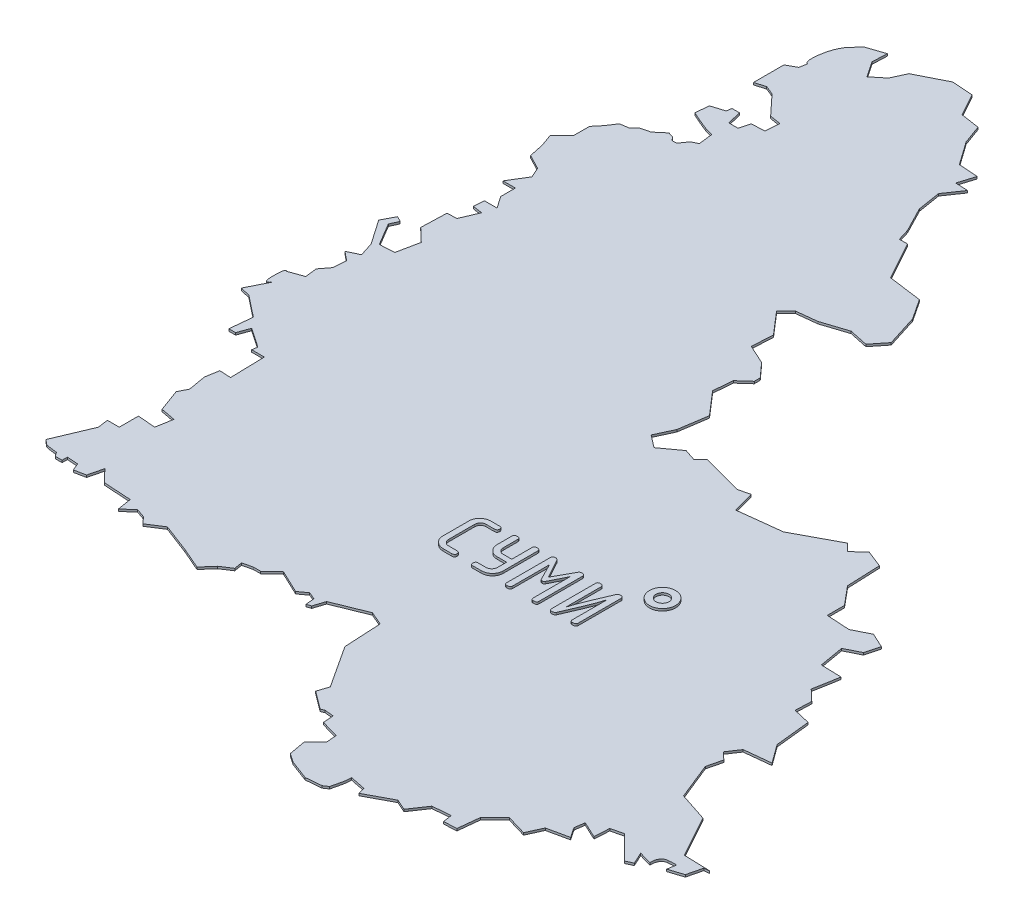
from build123d import *

# Parameters (mm, degrees)
EXTRUDE_2_DEPTH = 5
SKETCH_2_R      = 30
SKETCH_2_R_2    = 15
EXTRUDE_3_DEPTH = 10
SCALE_1_SCALE   = 0.05


with BuildPart() as part:
    # Эскиз1 → Бобышка-Вытянуть2 (new body)
    with BuildSketch(Plane(origin=(0, 0, 0), x_dir=(1, 0, 0), z_dir=(0, 1, 0))):
        with BuildLine():
            Line((879.09908, 7572.42834), (889.50546, 7563.34022))
            Line((889.50546, 7563.34022), (893.42468, 7562.0372))
            Line((893.42468, 7562.0372), (916.74442, 7558.79362))
            Line((916.74442, 7558.79362), (923.21126, 7549.71058))
            Line((923.21126, 7549.71058), (938.81448, 7549.71058))
            Line((938.81448, 7549.71058), (938.81448, 7562.0372))
            Line((938.81448, 7562.0372), (964.12812, 7560.07124))
            Line((964.12812, 7560.07124), (971.2706, 7543.21834))
            Line((971.2706, 7543.21834), (996.5944, 7548.40756))
            Line((996.5944, 7548.40756), (1004.99418, 7582.17178))
            Line((1004.99418, 7582.17178), (1032.26108, 7553.5917))
            Line((1032.26108, 7553.5917), (1095.84236, 7549.71058))
            Line((1095.84236, 7549.71058), (1101.0392, 7517.257))
            Line((1101.0392, 7517.257), (1124.3945, 7538.03928))
            Line((1124.3945, 7538.03928), (1145.18694, 7530.8841))
            Line((1145.18694, 7530.8841), (1158.8115, 7515.95652))
            Line((1158.8115, 7515.95652), (1193.18278, 7538.03928))
            Line((1193.18278, 7538.03928), (1259.4082, 7512.7104))
            Line((1259.4082, 7512.7104), (1307.40404, 7491.95352))
            Line((1307.40404, 7491.95352), (1329.48172, 7517.257))
            Line((1329.48172, 7517.257), (1353.4771, 7532.8272))
            Line((1353.4771, 7532.8272), (1350.25638, 7551.6486))
            Line((1350.25638, 7551.6486), (1372.31628, 7556.84798))
            Line((1372.31628, 7556.84798), (1389.16918, 7556.84798))
            Line((1389.16918, 7556.84798), (1416.43608, 7582.17178))
            Line((1416.43608, 7582.17178), (1469.62114, 7556.84798))
            Line((1469.62114, 7556.84798), (1488.43492, 7570.46746))
            Line((1488.43492, 7570.46746), (1505.34116, 7563.34022))
            Line((1505.34116, 7563.34022), (1507.26648, 7543.21834))
            Line((1507.26648, 7543.21834), (1517.015, 7546.46446))
            Line((1517.015, 7546.46446), (1525.45796, 7572.42834))
            Line((1525.45796, 7572.42834), (1600.73086, 7602.9185))
            Line((1600.73086, 7602.9185), (1631.85602, 7589.29394))
            Line((1631.85602, 7589.29394), (1636.42548, 7503.64006))
            Line((1636.42548, 7503.64006), (1700.02454, 7406.28694))
            Line((1700.02454, 7406.28694), (1691.57904, 7380.98854))
            Line((1691.57904, 7380.98854), (1732.42732, 7350.47806))
            Line((1732.42732, 7350.47806), (1740.90584, 7353.72926))
            Line((1740.90584, 7353.72926), (1761.00486, 7351.77854))
            Line((1761.00486, 7351.77854), (1762.96574, 7327.76792))
            Line((1762.96574, 7327.76792), (1803.8318, 7316.08392))
            Line((1803.8318, 7316.08392), (1805.76474, 7292.08346))
            Line((1805.76474, 7292.08346), (1779.84658, 7266.77236))
            Line((1779.84658, 7266.77236), (1786.98652, 7227.17376))
            Line((1786.98652, 7227.17376), (1807.07792, 7213.5492))
            Line((1807.07792, 7213.5492), (1851.84542, 7196.70138))
            Line((1851.84542, 7196.70138), (1887.54004, 7199.92972))
            Line((1887.54004, 7199.92972), (1897.94388, 7207.06204))
            add(Edge.make_bspline(
                [(1904.705552798, 7250.097162508), (1907.778973749, 7244.241091087), (1897.94388, 7207.06204)],
                knots=[0.799002099, 0.799002099, 0.799002099, 0.802469136, 0.802469136, 0.802469136], degree=2))
            add(Edge.make_bspline(
                [(1940.768280005, 7242.746499999), (1912.10791526, 7248.151202402), (1904.705552798, 7250.097162508)],
                knots=[0.794238683, 0.794238683, 0.794238683, 0.796872225, 0.796872225, 0.796872225], degree=2))
            Line((1940.768280005, 7242.746499999), (1945.309800005, 7227.173759999))
            Line((1945.309800005, 7227.173759999), (2003.701860005, 7258.334479999))
            Line((2003.701860005, 7258.334479999), (2028.377960005, 7247.300719999))
            Line((2028.377960005, 7247.300719999), (2032.886460005, 7253.145259999))
            Line((2032.886460005, 7253.145259999), (2054.979380005, 7285.588679999))
            Line((2054.979380005, 7285.588679999), (2095.863220005, 7288.839879999))
            Line((2095.863220005, 7288.839879999), (2099.101720005, 7268.065219999))
            Line((2099.101720005, 7268.065219999), (2128.293940005, 7270.008319999))
            Line((2128.293940005, 7270.008319999), (2133.490780005, 7319.332579999))
            Line((2133.490780005, 7319.332579999), (2167.249920005, 7351.778539999))
            Line((2167.249920005, 7351.778539999), (2213.330600005, 7338.141279999))
            Line((2213.330600005, 7338.141279999), (2228.931280005, 7372.543039999))
            Line((2228.931280005, 7372.543039999), (2276.911880005, 7382.929099999))
            Line((2276.911880005, 7382.929099999), (2261.344220005, 7406.286939999))
            Line((2261.344220005, 7406.286939999), (2264.582720005, 7429.002159999))
            Line((2264.582720005, 7429.002159999), (2302.217900005, 7411.486319999))
            Line((2302.217900005, 7411.486319999), (2304.186400005, 7445.877919999))
            Line((2304.186400005, 7445.877919999), (2331.445680005, 7452.375239999))
            Line((2331.445680005, 7452.375239999), (2385.933760005, 7397.861759999))
            Line((2385.933760005, 7397.861759999), (2401.511580005, 7404.999159999))
            Line((2401.511580005, 7404.999159999), (2389.172260005, 7432.248279999))
            Line((2389.172260005, 7432.248279999), (2418.372100005, 7423.812939999))
            add(Edge.make_bspline(
                [(2435.252940005, 7449.129119999), (2418.372100005, 7447.815939999), (2418.372100005, 7423.812939999)],
                knots=[0.699588477, 0.699588477, 0.699588477, 0.703703704, 0.703703704, 0.703703704], degree=2))
            add(Edge.make_bspline(
                [(2454.084500005, 7449.129119999), (2452.781480005, 7451.067139999), (2435.252940005, 7449.129119999)],
                knots=[0.695473251, 0.695473251, 0.695473251, 0.699588477, 0.699588477, 0.699588477], degree=2))
            Line((2454.084500005, 7449.129119999), (2450.846000005, 7430.292479999))
            Line((2450.846000005, 7430.292479999), (2483.302120005, 7440.688699999))
            Line((2483.302120005, 7440.688699999), (2491.712060005, 7475.085379999))
            Line((2491.712060005, 7475.085379999), (2504.059000005, 7475.730539999))
            Line((2504.059000005, 7475.730539999), (2503.375740005, 7476.380779999))
            Line((2503.375740005, 7476.380779999), (2443.688280005, 7478.323879999))
            Line((2443.688280005, 7478.323879999), (2391.133140005, 7573.705959999))
            Line((2391.133140005, 7573.705959999), (2324.305740005, 7595.783639999))
            Line((2324.305740005, 7595.783639999), (2290.518660005, 7679.489339999))
            Line((2290.518660005, 7679.489339999), (2298.989560005, 7713.893639999))
            Line((2298.989560005, 7713.893639999), (2282.083320005, 7729.466379999))
            Line((2282.083320005, 7729.466379999), (2300.292580005, 7756.723119999))
            Line((2300.292580005, 7756.723119999), (2360.627740005, 7763.197579999))
            Line((2360.627740005, 7763.197579999), (2329.484800005, 7806.037219999))
            Line((2329.484800005, 7806.037219999), (2321.049460005, 7885.849099999))
            Line((2321.049460005, 7885.849099999), (2282.083320005, 7894.942299999))
            Line((2282.083320005, 7894.942299999), (2283.404120005, 7931.929779999))
            Line((2283.404120005, 7931.929779999), (2258.080320005, 7955.948019999))
            Line((2258.080320005, 7955.948019999), (2268.466380005, 8014.340079999))
            Line((2268.466380005, 8014.340079999), (2221.791340005, 8015.632939999))
            Line((2221.791340005, 8015.632939999), (2212.017420005, 8072.102219999))
            Line((2212.017420005, 8072.102219999), (2245.768940005, 8088.977979999))
            Line((2245.768940005, 8088.977979999), (2254.186500005, 8121.423939999))
            Line((2254.186500005, 8121.423939999), (2220.452760005, 8137.004299999))
            Line((2220.452760005, 8137.004299999), (2182.817580005, 8118.180359999))
            Line((2182.817580005, 8118.180359999), (2129.604580005, 8121.423939999))
            Line((2129.604580005, 8121.423939999), (2129.604580005, 8161.002219999))
            Line((2129.604580005, 8161.002219999), (2093.930280005, 8203.831699999))
            Line((2093.930280005, 8203.831699999), (2090.681620005, 8280.412699999))
            Line((2090.681620005, 8280.412699999), (2051.761200005, 8295.987979999))
            Line((2051.761200005, 8295.987979999), (2025.771920005, 8271.979899999))
            Line((2025.771920005, 8271.979899999), (2008.901240005, 8288.837879999))
            Line((2008.901240005, 8288.837879999), (1912.871460005, 8237.570519999))
            Line((1912.871460005, 8237.570519999), (1814.243260005, 8225.891599999))
            Line((1814.243260005, 8225.891599999), (1800.593300005, 8275.210779999))
            Line((1800.593300005, 8275.210779999), (1774.629420005, 8268.731239999))
            Line((1774.629420005, 8268.731239999), (1681.210760005, 8294.037259999))
            Line((1681.210760005, 8294.037259999), (1665.635480005, 8278.459439999))
            Line((1665.635480005, 8278.459439999), (1638.366040005, 8287.552639999))
            Line((1638.366040005, 8287.552639999), (1595.534020005, 8256.404619999))
            Line((1595.534020005, 8256.404619999), (1566.979340005, 8278.459439999))
            Line((1566.979340005, 8278.459439999), (1585.803280005, 8319.355979999))
            Line((1585.803280005, 8319.355979999), (1595.534020005, 8384.227579999))
            Line((1595.534020005, 8384.227579999), (1549.445720005, 8437.453279999))
            Line((1549.445720005, 8437.453279999), (1553.364940005, 8481.583239999))
            Line((1553.364940005, 8481.583239999), (1578.670960005, 8504.290839999))
            Line((1578.670960005, 8504.290839999), (1578.670960005, 8517.920479999))
            Line((1578.670960005, 8517.920479999), (1549.445720005, 8550.371519999))
            Line((1549.445720005, 8550.371519999), (1505.341160005, 8570.475619999))
            Line((1505.341160005, 8570.475619999), (1508.597440005, 8618.512099999))
            Line((1508.597440005, 8618.512099999), (1464.442080005, 8669.759139999))
            Line((1464.442080005, 8669.759139999), (1486.519760005, 8691.831739999))
            Line((1486.519760005, 8691.831739999), (1532.615680005, 8697.028579999))
            Line((1532.615680005, 8697.028579999), (1590.334640005, 8715.842359999))
            Line((1590.334640005, 8715.842359999), (1633.159040005, 8706.761859999))
            Line((1633.159040005, 8706.761859999), (1659.158480005, 8739.197659999))
            Line((1659.158480005, 8739.197659999), (1636.425480005, 8811.242219999))
            Line((1636.425480005, 8811.242219999), (1605.894680005, 8857.325439999))
            Line((1605.894680005, 8857.325439999), (1529.326380005, 8867.691179999))
            Line((1529.326380005, 8867.691179999), (1481.320380005, 8954.645539999))
            Line((1481.320380005, 8954.645539999), (1462.506600005, 8954.645539999))
            Line((1462.506600005, 8954.645539999), (1454.081420005, 8981.907359999))
            Line((1454.081420005, 8981.907359999), (1424.863800005, 9038.361399999))
            Line((1424.863800005, 9038.361399999), (1416.436080005, 9090.931779999))
            Line((1416.436080005, 9090.931779999), (1443.677580005, 9130.510059999))
            Line((1443.677580005, 9130.510059999), (1415.122900005, 9131.818159999))
            Line((1415.122900005, 9131.818159999), (1426.822140005, 9169.453339999))
            Line((1426.822140005, 9169.453339999), (1382.676940005, 9172.709619999))
            Line((1382.676940005, 9172.709619999), (1345.039220005, 9225.917539999))
            Line((1345.039220005, 9225.917539999), (1329.481720005, 9268.747019999))
            Line((1329.481720005, 9268.747019999), (1286.611600005, 9275.221479999))
            Line((1286.611600005, 9275.221479999), (1258.095020005, 9326.496459999))
            Line((1258.095020005, 9326.496459999), (1210.071240005, 9329.742579999))
            Line((1210.071240005, 9329.742579999), (1143.218440005, 9295.985979999))
            Line((1143.218440005, 9295.985979999), (1128.306100005, 9263.552719999))
            Line((1128.306100005, 9263.552719999), (1101.039200005, 9241.490279999))
            Line((1101.039200005, 9241.490279999), (1077.020960005, 9277.182359999))
            Line((1077.020960005, 9277.182359999), (1078.359540005, 9310.923719999))
            Line((1078.359540005, 9310.923719999), (1037.450300005, 9297.294079999))
            Line((1037.450300005, 9297.294079999), (1017.315720005, 9273.938779999))
            add(Edge.make_bspline(
                [(1001.773460005, 9227.855559999), (1004.994180005, 9255.112299999), (1017.315720005, 9273.938779999)],
                knots=[0.362139918, 0.362139918, 0.362139918, 0.366255144, 0.366255144, 0.366255144], degree=2))
            add(Edge.make_bspline(
                [(1006.955060005, 9198.658259999), (998.501940005, 9200.596279999), (1001.773460005, 9227.855559999)],
                knots=[0.358024691, 0.358024691, 0.358024691, 0.362139918, 0.362139918, 0.362139918], degree=2))
            Line((1006.955060005, 9198.658259999), (1003.716560005, 9181.774879999))
            Line((1003.716560005, 9181.774879999), (981.649040005, 9169.453339999))
            Line((981.649040005, 9169.453339999), (981.649040005, 9099.372199999))
            Line((981.649040005, 9099.372199999), (1004.994180005, 9106.499439999))
            Line((1004.994180005, 9106.499439999), (1025.768840005, 9098.071719999))
            Line((1025.768840005, 9098.071719999), (1068.603400005, 9051.991039999))
            Line((1068.603400005, 9051.991039999), (1093.917040005, 9048.089599999))
            Line((1093.917040005, 9048.089599999), (1091.973940005, 9015.646179999))
            Line((1091.973940005, 9015.646179999), (1061.460920005, 9014.338079999))
            Line((1061.460920005, 9014.338079999), (1054.994080005, 8990.342699999))
            Line((1054.994080005, 8990.342699999), (1034.211800005, 8990.342699999))
            Line((1034.211800005, 8990.342699999), (1025.768840005, 9022.798819999))
            Line((1025.768840005, 9022.798819999), (1008.888000005, 9022.798819999))
            Line((1008.888000005, 9022.798819999), (1006.955060005, 9011.104659999))
            Line((1006.955060005, 9011.104659999), (977.745060005, 9002.034319999))
            Line((977.745060005, 9002.034319999), (974.524340005, 8971.526379999))
            Line((974.524340005, 8971.526379999), (993.320340005, 8963.073259999))
            Line((993.320340005, 8963.073259999), (1018.636520005, 8952.720219999))
            Line((1018.636520005, 8952.720219999), (1037.450300005, 8947.513219999))
            Line((1037.450300005, 8947.513219999), (1041.336500005, 8915.072339999))
            Line((1041.336500005, 8915.072339999), (1027.711940005, 8908.582639999))
            Line((1027.711940005, 8908.582639999), (1014.087380005, 8889.756159999))
            Line((1014.087380005, 8889.756159999), (1003.716560005, 8889.756159999))
            Line((1003.716560005, 8889.756159999), (996.594400005, 8898.191499999))
            Line((996.594400005, 8898.191499999), (984.885000005, 8901.424919999))
            Line((984.885000005, 8901.424919999), (962.789540005, 8882.621299999))
            Line((962.789540005, 8882.621299999), (942.068220005, 8877.426999999))
            Line((942.068220005, 8877.426999999), (930.368980005, 8865.748079999))
            Line((930.368980005, 8865.748079999), (909.579080005, 8862.494339999))
            Line((909.579080005, 8862.494339999), (895.987540005, 8841.729839999))
            Line((895.987540005, 8841.729839999), (880.404640005, 8822.916059999))
            Line((880.404640005, 8822.916059999), (880.404640005, 8787.229059999))
            Line((880.404640005, 8787.229059999), (853.145360005, 8759.959619999))
            Line((853.145360005, 8759.959619999), (863.533960005, 8730.762319999))
            Line((863.533960005, 8730.762319999), (870.673900005, 8697.028579999))
            Line((870.673900005, 8697.028579999), (904.405100005, 8679.494959999))
            Line((904.405100005, 8679.494959999), (914.793700005, 8656.142199999))
            Line((914.793700005, 8656.142199999), (889.505460005, 8614.618279999))
            Line((889.505460005, 8614.618279999), (918.0576, 8614.618279999))
            Line((918.0576, 8614.618279999), (918.0576, 8580.86676))
            Line((918.0576, 8580.86676), (936.8536, 8553.60494))
            Line((936.8536, 8553.60494), (907.6436, 8553.60494))
            Line((907.6436, 8553.60494), (906.35836, 8529.60194))
            Line((906.35836, 8529.60194), (928.44366, 8526.35582))
            Line((928.44366, 8526.35582), (911.58314, 8486.75722))
            Line((911.58314, 8486.75722), (889.50546, 8485.47198))
            Line((889.50546, 8485.47198), (887.5522, 8427.06214))
            Line((887.5522, 8427.06214), (918.0576, 8397.86738))
            Line((918.0576, 8397.86738), (907.6436, 8347.24518))
            Line((907.6436, 8347.24518), (873.90986, 8345.297))
            Line((873.90986, 8345.297), (843.41462, 8396.5796))
            Line((843.41462, 8396.5796), (851.89568, 8415.38576))
            Line((851.89568, 8415.38576), (839.53096, 8421.878))
            Line((839.53096, 8421.878), (824.59322, 8393.32078))
            Line((824.59322, 8393.32078), (863.53396, 8336.85658))
            Line((863.53396, 8336.85658), (873.90986, 8304.42332))
            Line((873.90986, 8304.42332), (847.97392, 8292.08146))
            Line((847.97392, 8292.08146), (868.71302, 8275.21078))
            Line((868.71302, 8275.21078), (866.76992, 8246.01348))
            Line((866.76992, 8246.01348), (849.91702, 8223.9485))
            Line((849.91702, 8223.9485), (853.14536, 8196.69938))
            Line((853.14536, 8196.69938), (820.70702, 8185.00522))
            add(Edge.make_bspline(
                [(814.22494, 8161.00222), (814.22494, 8191.50762), (820.70702, 8185.00522)],
                knots=[0.098765432, 0.098765432, 0.098765432, 0.102880658, 0.102880658, 0.102880658], degree=2))
            add(Edge.make_bspline(
                [(825.91402, 8147.37766), (814.22494, 8130.5019), (814.22494, 8161.00222)],
                knots=[0.094650206, 0.094650206, 0.094650206, 0.098765432, 0.098765432, 0.098765432], degree=2))
            Line((825.91402, 8147.37766), (801.89324, 8099.36658))
            Line((801.89324, 8099.36658), (824.59322, 8094.15704))
            Line((824.59322, 8094.15704), (873.90986, 8055.22646))
            Line((873.90986, 8055.22646), (868.71302, 8003.96418))
            Line((868.71302, 8003.96418), (884.28068, 8003.96418))
            Line((884.28068, 8003.96418), (894.04698, 8031.20568))
            Line((894.04698, 8031.20568), (938.81448, 8000.70536))
            Line((938.81448, 8000.70536), (936.8536, 7988.3889))
            Line((936.8536, 7988.3889), (966.0636, 7988.3889))
            Line((966.0636, 7988.3889), (967.99654, 7908.56686))
            Line((967.99654, 7908.56686), (942.06822, 7909.87496))
            Line((942.06822, 7909.87496), (936.8536, 7879.36956))
            Line((936.8536, 7879.36956), (944.0037, 7838.48318))
            Line((944.0037, 7838.48318), (933.64304, 7817.70852))
            Line((933.64304, 7817.70852), (952.41364, 7766.46148))
            Line((952.41364, 7766.46148), (986.1804, 7759.96162))
            Line((986.1804, 7759.96162), (979.68816, 7722.33914))
            Line((979.68816, 7722.33914), (938.81448, 7725.5624))
            Line((938.81448, 7725.5624), (938.81448, 7681.4553))
            Line((938.81448, 7681.4553), (911.58314, 7681.4553))
            Line((911.58314, 7681.4553), (914.7937, 7657.4269))
            Line((914.7937, 7657.4269), (879.09908, 7572.42834))
        make_face()
    extrude(amount=EXTRUDE_2_DEPTH)

    # Эскиз2 → Бобышка-Вытянуть3 (add)
    # profile 1 of 5: a face of its own
    with BuildSketch(Plane(origin=(0, 0, 0), x_dir=(1, 0, 0), z_dir=(0, 1, 0))):
        with Locations((1910.21910007, 7961.332933556)):
            Circle(SKETCH_2_R)
        with Locations((1910.21910007, 7961.332933556)):
            Circle(SKETCH_2_R_2, mode=Mode.SUBTRACT)
    # profile 2 of 5: a face of its own
    with BuildSketch(Plane(origin=(0, 0, 0), x_dir=(1, 0, 0), z_dir=(0, 1, 0))):
        with BuildLine():
            Line((1578.562321814, 7807.069016626), (1559.400581949, 7807.069016626))
            add(Edge.make_bspline(
                [(1559.400581949, 7807.069016626), (1558.56346375, 7807.093002103), (1556.906156653, 7807.140487991), (1554.454497929, 7807.469129855), (1552.084266485, 7808.028919047), (1549.781506886, 7808.803528493), (1547.55136386, 7809.797095835), (1545.407764698, 7811.044675055), (1543.33610776, 7812.492172903), (1541.346370335, 7814.121631339), (1539.542024346, 7815.93342505), (1537.936381697, 7817.853528532), (1536.581477029, 7819.886058195), (1535.467759027, 7822.019227873), (1534.594042915, 7824.244877162), (1533.996664084, 7826.569709102), (1533.607624322, 7828.989286653), (1533.569150559, 7830.642234155), (1533.549652895, 7831.479911896)],
                knots=[0, 0, 0, 0, 1.018867561, 2.017130245, 3.004614605, 3.979107864, 4.970407086, 5.970980155, 6.993154606, 8.044116266, 9.096977523, 10.100873513, 11.086242139, 12.064146942, 13.024919106, 13.989519707, 14.981132439, 16, 16, 16, 16], degree=3))
            Line((1533.549652895, 7831.479911896), (1533.549652895, 7892.658121356))
            add(Edge.make_bspline(
                [(1533.549652895, 7892.658121356), (1533.56845312, 7893.495914719), (1533.605378814, 7895.141432295), (1534.00281731, 7897.559321641), (1534.59023201, 7899.886151898), (1535.462170421, 7902.114160709), (1536.588413502, 7904.232827419), (1537.935749824, 7906.261476747), (1539.541320635, 7908.182303384), (1541.353555489, 7909.992567638), (1543.330100339, 7911.644063456), (1545.404015142, 7913.107074115), (1547.578923877, 7914.293874553), (1549.784869638, 7915.354375262), (1552.096119426, 7916.09716785), (1554.460787139, 7916.673736793), (1556.906464907, 7916.996556379), (1558.563567198, 7917.044699285), (1559.400581949, 7917.069016626)],
                knots=[0, 0, 0, 0, 1.0191145, 2.001652071, 2.975606382, 3.936611404, 4.906405939, 5.892013384, 6.896152684, 7.949269119, 9.006511641, 10.028933832, 11.033294323, 12.020163057, 13.003830373, 13.982380872, 14.9808855, 16, 16, 16, 16], degree=3))
            Line((1559.400581949, 7917.069016626), (1578.562321814, 7917.069016626))
            add(Edge.make_bspline(
                [(1578.562321814, 7917.069016626), (1579.097710196, 7917.053154765), (1580.107077731, 7917.023250404), (1581.515776313, 7916.753332785), (1582.713873491, 7916.280935001), (1583.71645491, 7915.63482859), (1584.482973588, 7914.762502306), (1585.031199111, 7913.713224442), (1585.321110815, 7912.469680691), (1585.366733412, 7911.588984794), (1585.390869112, 7911.12307068)],
                knots=[0, 0, 0, 0, 1.239032302, 2.335947183, 3.301339876, 4.206248485, 5.069721959, 5.959770044, 6.920658157, 8, 8, 8, 8], degree=3))
            add(Edge.make_bspline(
                [(1585.390869112, 7911.12307068), (1585.366733412, 7910.657156566), (1585.321110815, 7909.776460669), (1585.031199111, 7908.532916918), (1584.482973588, 7907.483639053), (1583.71645491, 7906.61131277), (1582.713873491, 7905.965206358), (1581.515776313, 7905.492808575), (1580.107077731, 7905.222890956), (1579.097710196, 7905.192986595), (1578.562321814, 7905.177124734)],
                knots=[0, 0, 0, 0, 1.079341843, 2.040229956, 2.930278041, 3.793751515, 4.698660124, 5.664052817, 6.760967698, 8, 8, 8, 8], degree=3))
            Line((1578.562321814, 7905.177124734), (1559.400581949, 7905.177124734))
            add(Edge.make_bspline(
                [(1559.400581949, 7905.177124734), (1558.620767333, 7905.133785809), (1557.06792344, 7905.047485059), (1554.810636234, 7904.300616221), (1552.671969905, 7903.125908515), (1550.722421981, 7901.495329681), (1549.014370307, 7899.543480367), (1547.811401215, 7897.198660568), (1547.036881339, 7894.596175739), (1546.965008257, 7892.749048946), (1546.928031274, 7891.798746356)],
                knots=[0, 0, 0, 0, 0.919483398, 1.830966167, 2.780942374, 3.788393713, 4.820470715, 5.823133069, 6.880053989, 8, 8, 8, 8], degree=3))
            Line((1546.928031274, 7891.798746356), (1546.928031274, 7832.339286896))
            add(Edge.make_bspline(
                [(1546.928031274, 7832.339286896), (1546.966449005, 7831.381926802), (1547.040444958, 7829.537966474), (1547.78567409, 7826.916263976), (1549.015884415, 7824.591042165), (1550.697710172, 7822.603563353), (1552.661596618, 7821.000715513), (1554.803432774, 7819.829486115), (1557.061332729, 7819.093508065), (1558.621037948, 7819.005096704), (1559.400581949, 7818.960908518)],
                knots=[0, 0, 0, 0, 1.127983622, 2.172596354, 3.186649798, 4.21184702, 5.225406005, 6.162066987, 7.081397153, 8, 8, 8, 8], degree=3))
            Line((1559.400581949, 7818.960908518), (1578.562321814, 7818.960908518))
            add(Edge.make_bspline(
                [(1578.562321814, 7818.960908518), (1579.097710196, 7818.945046657), (1580.107077731, 7818.915142296), (1581.515776313, 7818.645224677), (1582.713873491, 7818.172826893), (1583.71645491, 7817.526720481), (1584.482973588, 7816.654394198), (1585.031199111, 7815.605116334), (1585.321110815, 7814.361572582), (1585.366733412, 7813.480876686), (1585.390869112, 7813.014962572)],
                knots=[0, 0, 0, 0, 1.239032302, 2.335947183, 3.301339876, 4.206248485, 5.069721959, 5.959770044, 6.920658157, 8, 8, 8, 8], degree=3))
            add(Edge.make_bspline(
                [(1585.390869112, 7813.014962572), (1585.366733412, 7812.549048458), (1585.321110815, 7811.668352561), (1585.031199111, 7810.42480881), (1584.482973588, 7809.375530945), (1583.71645491, 7808.503204662), (1582.713873491, 7807.85709825), (1581.515776313, 7807.384700466), (1580.107077731, 7807.114782848), (1579.097710196, 7807.084878487), (1578.562321814, 7807.069016626)],
                knots=[0, 0, 0, 0, 1.079341843, 2.040229956, 2.930278041, 3.793751515, 4.698660124, 5.664052817, 6.760967698, 8, 8, 8, 8], degree=3))
        make_face()
    # profile 3 of 5: a face of its own
    with BuildSketch(Plane(origin=(0, 0, 0), x_dir=(1, 0, 0), z_dir=(0, 1, 0))):
        with BuildLine():
            Line((1659.306409652, 7853.150097707), (1637.705902895, 7853.150097707))
            add(Edge.make_bspline(
                [(1637.705902895, 7853.150097707), (1636.868855667, 7853.174167631), (1635.219362663, 7853.221600047), (1632.796669878, 7853.543824708), (1630.476115464, 7854.116565872), (1628.241817037, 7854.869677009), (1626.110801904, 7855.882130456), (1624.086305778, 7857.121736207), (1622.153064557, 7858.570816206), (1620.321247587, 7860.20673738), (1618.677182483, 7862.022695931), (1617.213599201, 7863.944210555), (1615.985494339, 7865.961055948), (1614.974165082, 7868.077666773), (1614.180820002, 7870.286152492), (1613.626912509, 7872.591451758), (1613.294140338, 7874.988639793), (1613.248566686, 7876.615381639), (1613.225328571, 7877.44486122)],
                knots=[0, 0, 0, 0, 1.046542739, 2.062326793, 3.048388737, 4.031023869, 5.005279697, 5.991389151, 6.9942227, 8.022384199, 9.057041184, 10.052136522, 11.038245977, 12.003758709, 12.980463927, 13.966525871, 14.96312665, 16, 16, 16, 16], degree=3))
            Line((1613.225328571, 7877.44486122), (1613.225328571, 7911.773408518))
            add(Edge.make_bspline(
                [(1613.225328571, 7911.773408518), (1613.241761367, 7912.185310873), (1613.273191467, 7912.973133731), (1613.546473318, 7914.075958832), (1614.020409431, 7915.016816634), (1614.691304623, 7915.784155523), (1615.555601668, 7916.373041606), (1616.59921929, 7916.795363348), (1617.831078161, 7917.010594425), (1618.706024214, 7917.048735309), (1619.171274517, 7917.069016626)],
                knots=[0, 0, 0, 0, 1.083429305, 2.072215321, 2.965634013, 3.832377457, 4.725796149, 5.694844779, 6.774239667, 8, 8, 8, 8], degree=3))
            add(Edge.make_bspline(
                [(1619.171274517, 7917.069016626), (1619.753458628, 7917.062778726), (1620.846967456, 7917.05106216), (1622.364247355, 7916.781339213), (1623.675743591, 7916.413693569), (1624.736037194, 7915.820264064), (1625.598803075, 7915.087828547), (1626.181078469, 7914.152552462), (1626.550647543, 7913.062141932), (1626.585353821, 7912.279948112), (1626.603706949, 7911.866313923)],
                knots=[0, 0, 0, 0, 1.353106154, 2.541521659, 3.579288285, 4.507284885, 5.350131461, 6.185231121, 7.040326791, 8, 8, 8, 8], degree=3))
            Line((1626.603706949, 7911.866313923), (1626.603706949, 7878.373915274))
            add(Edge.make_bspline(
                [(1626.603706949, 7878.373915274), (1626.644196434, 7877.42453952), (1626.722399696, 7875.590871287), (1627.439851164, 7872.99337818), (1628.598588924, 7870.671243873), (1630.206864773, 7868.696125643), (1632.077814739, 7867.084606414), (1634.115982338, 7865.923944977), (1636.252826106, 7865.170815383), (1637.730824826, 7865.085030132), (1638.47237249, 7865.041989599)],
                knots=[0, 0, 0, 0, 1.148644306, 2.218544726, 3.238301574, 4.272931153, 5.284625871, 6.213417378, 7.103628338, 8, 8, 8, 8], degree=3))
            Line((1638.47237249, 7865.041989599), (1659.306409652, 7865.041989599))
            Line((1659.306409652, 7865.041989599), (1659.306409652, 7911.866313923))
            add(Edge.make_bspline(
                [(1659.306409652, 7911.866313923), (1659.320818633, 7912.278817382), (1659.347853265, 7913.052770771), (1659.638512498, 7914.133875158), (1660.093241147, 7915.062973312), (1660.782178945, 7915.804939846), (1661.62998183, 7916.404444895), (1662.689698607, 7916.779718621), (1663.906984218, 7917.0504732), (1664.785980374, 7917.062588516), (1665.252355598, 7917.069016626)],
                knots=[0, 0, 0, 0, 1.091529518, 2.047965782, 2.948064081, 3.805939007, 4.706037306, 5.674741692, 6.76627121, 8, 8, 8, 8], degree=3))
            add(Edge.make_bspline(
                [(1665.252355598, 7917.069016626), (1665.833591101, 7917.048717294), (1666.923767254, 7917.010643487), (1668.453205455, 7916.798071791), (1669.751194934, 7916.381603224), (1670.825790454, 7915.800793879), (1671.680377889, 7915.037976475), (1672.262724632, 7914.082161728), (1672.631452903, 7912.968526638), (1672.666346889, 7912.171436672), (1672.684788031, 7911.750182166)],
                knots=[0, 0, 0, 0, 1.342902474, 2.518772933, 3.553495682, 4.473922706, 5.321854953, 6.165250748, 7.030352379, 8, 8, 8, 8], degree=3))
            Line((1672.684788031, 7911.750182166), (1672.684788031, 7831.479911896))
            add(Edge.make_bspline(
                [(1672.684788031, 7831.479911896), (1672.663052514, 7830.681155432), (1672.62000357, 7829.099153815), (1672.258102172, 7826.764381389), (1671.683369108, 7824.504911002), (1670.855022524, 7822.320993214), (1669.809158793, 7820.215716783), (1668.554563481, 7818.169689576), (1667.014428502, 7816.241308388), (1665.302809782, 7814.38110061), (1663.413397425, 7812.667570028), (1661.371963012, 7811.170790877), (1659.218292155, 7809.881565319), (1656.916549729, 7808.869151983), (1654.522296891, 7808.035431568), (1651.992959726, 7807.499152008), (1649.353223262, 7807.129158525), (1647.547493926, 7807.089355001), (1646.624821814, 7807.069016626)],
                knots=[0, 0, 0, 0, 0.964905936, 1.911074051, 2.848363436, 3.778149884, 4.728058265, 5.686180386, 6.672623048, 7.705544358, 8.739058838, 9.749658205, 10.760647355, 11.765817439, 12.783711154, 13.818918533, 14.885534502, 16, 16, 16, 16], degree=3))
            Line((1646.624821814, 7807.069016626), (1627.463081949, 7807.069016626))
            add(Edge.make_bspline(
                [(1627.463081949, 7807.069016626), (1627.042941105, 7807.083521386), (1626.253935523, 7807.110760672), (1625.149410921, 7807.400774768), (1624.200259628, 7807.856380108), (1623.429499802, 7808.53583632), (1622.840106774, 7809.399040138), (1622.417936611, 7810.442984639), (1622.202658843, 7811.674742823), (1622.164525041, 7812.549704148), (1622.14424749, 7813.014962572)],
                knots=[0, 0, 0, 0, 1.101172267, 2.067951921, 2.977421716, 3.842135725, 4.733462525, 5.700242178, 6.77710972, 8, 8, 8, 8], degree=3))
            add(Edge.make_bspline(
                [(1622.14424749, 7813.014962572), (1622.164731911, 7813.480069675), (1622.203254753, 7814.354746428), (1622.415967546, 7815.588380822), (1622.844786665, 7816.622188455), (1623.402976248, 7817.50253667), (1624.170945136, 7818.157613589), (1625.088471714, 7818.641363655), (1626.170529016, 7818.912712402), (1626.94289384, 7818.944354968), (1627.346950193, 7818.960908518)],
                knots=[0, 0, 0, 0, 1.236521053, 2.325391746, 3.302947472, 4.192640581, 5.066993003, 5.950007355, 6.927563081, 8, 8, 8, 8], degree=3))
            Line((1627.346950193, 7818.960908518), (1645.881578571, 7818.960908518))
            add(Edge.make_bspline(
                [(1645.881578571, 7818.960908518), (1646.776768113, 7819.011211984), (1648.52774518, 7819.109604796), (1651.059008222, 7819.853895191), (1653.359752094, 7821.116203667), (1655.423531953, 7822.80468879), (1657.117042908, 7824.856875255), (1658.423388688, 7827.136899646), (1659.155322834, 7829.671129449), (1659.255297474, 7831.421288973), (1659.306409652, 7832.316060545)],
                knots=[0, 0, 0, 0, 1.020971316, 1.997004296, 2.981641766, 3.998934447, 5.021854658, 6.002995704, 6.979028684, 8, 8, 8, 8], degree=3))
            Line((1659.306409652, 7832.316060545), (1659.306409652, 7853.150097707))
        make_face()
    # profile 4 of 5: a face of its own
    with BuildSketch(Plane(origin=(0, 0, 0), x_dir=(1, 0, 0), z_dir=(0, 1, 0))):
        with BuildLine():
            add(Edge.make_bspline(
                [(1774.657761003, 7812.411077437), (1774.637796705, 7811.990390137), (1774.599670273, 7811.186990752), (1774.247639295, 7810.065610765), (1773.645411615, 7809.11959825), (1772.793623819, 7808.363214373), (1771.731497228, 7807.750726486), (1770.425002656, 7807.342161299), (1768.897101158, 7807.126714473), (1767.806689588, 7807.089081124), (1767.225328571, 7807.069016626)],
                knots=[0, 0, 0, 0, 0.968349646, 1.849286893, 2.676465977, 3.523263178, 4.451261044, 5.484598709, 6.658895142, 8, 8, 8, 8], degree=3))
            add(Edge.make_bspline(
                [(1767.225328571, 7807.069016626), (1766.759943074, 7807.089108431), (1765.884742777, 7807.126892921), (1764.654560164, 7807.34447374), (1763.601299232, 7807.7608279), (1762.75235751, 7808.379338142), (1762.07337309, 7809.142914852), (1761.600859818, 7810.085758814), (1761.3252571, 7811.195560448), (1761.295224151, 7811.99133109), (1761.279382625, 7812.411077437)],
                knots=[0, 0, 0, 0, 1.220860227, 2.29594012, 3.261114875, 4.162696787, 5.025975332, 5.915822489, 6.900655729, 8, 8, 8, 8], degree=3))
            Line((1761.279382625, 7812.411077437), (1761.279382625, 7897.37307068))
            Line((1761.279382625, 7897.37307068), (1742.442811679, 7859.862513247))
            add(Edge.make_bspline(
                [(1742.442811679, 7859.862513247), (1742.121589864, 7859.380263552), (1741.499915945, 7858.446945686), (1740.108981717, 7857.475886556), (1738.50368966, 7856.823691301), (1737.324742817, 7856.775485716), (1736.705902895, 7856.750182166)],
                knots=[0, 0, 0, 0, 1.006547439, 1.948013064, 2.922893393, 4, 4, 4, 4], degree=3))
            add(Edge.make_bspline(
                [(1736.705902895, 7856.750182166), (1736.257671985, 7856.81414981), (1735.302649451, 7856.950442377), (1734.044294863, 7858.009905483), (1732.951539509, 7859.592927045), (1732.363430476, 7860.887068931), (1732.037406274, 7861.604489599)],
                knots=[0, 0, 0, 0, 0.752435078, 1.603174698, 2.671295606, 4, 4, 4, 4], degree=3))
            Line((1732.037406274, 7861.604489599), (1713.711815058, 7897.37307068))
            Line((1713.711815058, 7897.37307068), (1713.711815058, 7812.411077437))
            add(Edge.make_bspline(
                [(1713.711815058, 7812.411077437), (1713.691850759, 7811.990390137), (1713.653724327, 7811.186990752), (1713.301693349, 7810.065610765), (1712.699465669, 7809.11959825), (1711.847677873, 7808.363214373), (1710.785551282, 7807.750726486), (1709.47905671, 7807.342161299), (1707.951155212, 7807.126714473), (1706.860743642, 7807.089081124), (1706.279382625, 7807.069016626)],
                knots=[0, 0, 0, 0, 0.968349646, 1.849286893, 2.676465977, 3.523263178, 4.451261044, 5.484598709, 6.658895142, 8, 8, 8, 8], degree=3))
            add(Edge.make_bspline(
                [(1706.279382625, 7807.069016626), (1705.813997128, 7807.089108431), (1704.938796831, 7807.126892921), (1703.708614218, 7807.34447374), (1702.655353286, 7807.7608279), (1701.806411564, 7808.379338142), (1701.127427144, 7809.142914852), (1700.654913872, 7810.085758814), (1700.379311154, 7811.195560448), (1700.349278205, 7811.99133109), (1700.333436679, 7812.411077437)],
                knots=[0, 0, 0, 0, 1.220860227, 2.29594012, 3.261114875, 4.162696787, 5.025975332, 5.915822489, 6.900655729, 8, 8, 8, 8], degree=3))
            Line((1700.333436679, 7812.411077437), (1700.333436679, 7912.586330815))
            add(Edge.make_bspline(
                [(1700.333436679, 7912.586330815), (1700.347643475, 7913.052995979), (1700.374458437, 7913.93381448), (1700.669054619, 7915.161022697), (1701.084785107, 7916.238594762), (1701.765734114, 7917.092095097), (1702.602284504, 7917.76972458), (1703.626643186, 7918.228023122), (1704.823899533, 7918.514012074), (1705.681368741, 7918.54104392), (1706.140024517, 7918.555503112)],
                knots=[0, 0, 0, 0, 1.17117569, 2.210564007, 3.161919999, 4.050178772, 4.923145732, 5.846785378, 6.848256806, 8, 8, 8, 8], degree=3))
            add(Edge.make_bspline(
                [(1706.140024517, 7918.555503112), (1706.866887199, 7918.515379264), (1708.296836825, 7918.43644402), (1710.31900948, 7917.669806235), (1712.145673606, 7916.456717059), (1713.116267929, 7915.345219256), (1713.618909652, 7914.769607842)],
                knots=[0, 0, 0, 0, 1.000789268, 1.968842638, 2.94812445, 4, 4, 4, 4], degree=3))
            Line((1713.618909652, 7914.769607842), (1737.333014382, 7871.313104464))
            Line((1737.333014382, 7871.313104464), (1761.488419787, 7915.396719329))
            add(Edge.make_bspline(
                [(1761.488419787, 7915.396719329), (1761.901069715, 7915.884103591), (1762.686084812, 7916.811291452), (1764.151876221, 7917.794776341), (1765.705902715, 7918.468276995), (1766.808013373, 7918.526230795), (1767.364686679, 7918.555503112)],
                knots=[0, 0, 0, 0, 1.103169351, 2.098642303, 3.039629035, 4, 4, 4, 4], degree=3))
            add(Edge.make_bspline(
                [(1767.364686679, 7918.555503112), (1767.938935187, 7918.540768895), (1769.010135148, 7918.513283769), (1770.507853113, 7918.234285067), (1771.786033673, 7917.772985157), (1772.857695478, 7917.128556869), (1773.689748487, 7916.255573364), (1774.236819966, 7915.178849007), (1774.60423653, 7913.941543398), (1774.63929721, 7913.053824726), (1774.657761003, 7912.586330815)],
                knots=[0, 0, 0, 0, 1.27863041, 2.385150032, 3.378693851, 4.293134735, 5.147492946, 6.027426626, 6.961195624, 8, 8, 8, 8], degree=3))
            Line((1774.657761003, 7912.586330815), (1774.657761003, 7812.411077437))
        make_face()
    # profile 5 of 5: a face of its own
    with BuildSketch(Plane(origin=(0, 0, 0), x_dir=(1, 0, 0), z_dir=(0, 1, 0))):
        with BuildLine():
            add(Edge.make_bspline(
                [(1863.252355598, 7813.85111122), (1863.231676465, 7813.438293944), (1863.191833043, 7812.642900221), (1862.842481136, 7811.528452336), (1862.239151728, 7810.584355809), (1861.39449484, 7809.823068873), (1860.318405339, 7809.243122925), (1859.020887714, 7808.826381665), (1857.491299614, 7808.613896598), (1856.401146425, 7808.57580952), (1855.819923166, 7808.555503112)],
                knots=[0, 0, 0, 0, 0.953740082, 1.837614163, 2.667550865, 3.517171085, 4.439430397, 5.476212962, 6.654424219, 8, 8, 8, 8], degree=3))
            add(Edge.make_bspline(
                [(1855.819923166, 7808.555503112), (1855.354671992, 7808.575784222), (1854.479724301, 7808.613924717), (1853.247876227, 7808.829158361), (1852.204223552, 7809.251471769), (1851.340043741, 7809.840385722), (1850.668726441, 7810.607624265), (1850.199852584, 7811.542121211), (1849.91889072, 7812.63502327), (1849.889494452, 7813.415761323), (1849.87397722, 7813.827884869)],
                knots=[0, 0, 0, 0, 1.228791976, 2.310856505, 3.282301858, 4.177930221, 5.04681736, 5.942445723, 6.913891076, 8, 8, 8, 8], degree=3))
            Line((1849.87397722, 7813.827884869), (1849.87397722, 7893.796212572))
            add(Edge.make_bspline(
                [(1849.87397722, 7893.796212572), (1849.608939138, 7892.834436414), (1849.046569121, 7890.793695438), (1848.033144696, 7887.612393162), (1846.900844345, 7884.10560904), (1845.563646162, 7880.303190728), (1844.088882089, 7876.179938735), (1842.425809092, 7871.756358464), (1840.619938227, 7867.023587978), (1838.642152403, 7861.984676091), (1836.504894704, 7856.631756228), (1834.180119959, 7850.976138079), (1831.696186462, 7845.006345577), (1829.041422313, 7838.730361344), (1826.236931013, 7832.139252641), (1823.260483102, 7825.242470267), (1820.130826636, 7818.036227163), (1817.956860271, 7813.144981477), (1816.846105598, 7810.645874734)],
                knots=[0, 0, 0, 0, 0.534819233, 1.134804096, 1.789814632, 2.510503038, 3.295666462, 4.137599038, 5.044164315, 6.011541378, 7.039786653, 8.134359685, 9.289900099, 10.506440011, 11.787824629, 13.130253246, 14.53374704, 16, 16, 16, 16], degree=3))
            add(Edge.make_bspline(
                [(1816.846105598, 7810.645874734), (1816.482906856, 7810.097966004), (1815.760682728, 7809.008444322), (1814.068038502, 7807.862256065), (1812.003764645, 7807.182321343), (1810.4957812, 7807.108399276), (1809.692389382, 7807.069016626)],
                knots=[0, 0, 0, 0, 0.931236219, 1.851772014, 2.855512113, 4, 4, 4, 4], degree=3))
            add(Edge.make_bspline(
                [(1809.692389382, 7807.069016626), (1809.226109008, 7807.083593994), (1808.353568602, 7807.110872308), (1807.132584612, 7807.396015351), (1806.098991436, 7807.851948698), (1805.238308742, 7808.506684386), (1804.587232977, 7809.360484043), (1804.110031386, 7810.397289676), (1803.840401853, 7811.615611956), (1803.809263603, 7812.487162796), (1803.792896139, 7812.945283518)],
                knots=[0, 0, 0, 0, 1.171630376, 2.192446653, 3.134147218, 3.995415972, 4.884019595, 5.808017826, 6.847809664, 8, 8, 8, 8], degree=3))
            Line((1803.792896139, 7812.945283518), (1803.792896139, 7913.213442301))
            add(Edge.make_bspline(
                [(1803.792896139, 7913.213442301), (1803.808913456, 7913.633020344), (1803.839279679, 7914.428471908), (1804.11265318, 7915.540407807), (1804.595290356, 7916.48139705), (1805.250043699, 7917.270648808), (1806.124325789, 7917.858547497), (1807.166428678, 7918.28215352), (1808.398754126, 7918.496989005), (1809.273629412, 7918.53518989), (1809.738842085, 7918.555503112)],
                knots=[0, 0, 0, 0, 1.098843442, 2.08322802, 2.972669788, 3.850929026, 4.740370794, 5.705105844, 6.779695961, 8, 8, 8, 8], degree=3))
            add(Edge.make_bspline(
                [(1809.738842085, 7918.555503112), (1810.320019007, 7918.535147379), (1811.410085284, 7918.496967785), (1812.940240707, 7918.285086625), (1814.235972505, 7917.866444376), (1815.322411306, 7917.290026332), (1816.150844027, 7916.503260501), (1816.762617328, 7915.560638054), (1817.112764424, 7914.437033866), (1817.151166094, 7913.633959441), (1817.171274517, 7913.213442301)],
                knots=[0, 0, 0, 0, 1.340544031, 2.514349394, 3.547254935, 4.466065479, 5.324653274, 6.151486447, 7.032055301, 8, 8, 8, 8], degree=3))
            Line((1817.171274517, 7913.213442301), (1817.171274517, 7831.828307166))
            add(Edge.make_bspline(
                [(1817.171274517, 7831.828307166), (1817.428075309, 7832.790179328), (1817.971069667, 7834.824017119), (1818.967760665, 7838.006165031), (1820.099387644, 7841.507938062), (1821.404355441, 7845.316128409), (1822.869819144, 7849.426673923), (1824.497403906, 7853.849990612), (1826.309578074, 7858.577606438), (1828.292535046, 7863.611298632), (1830.392640139, 7868.975976185), (1832.73391814, 7874.618605979), (1835.178412614, 7880.60149654), (1837.843111494, 7886.859140744), (1840.62339947, 7893.449435835), (1843.593758311, 7900.341278504), (1846.760918606, 7907.531051761), (1848.914333417, 7912.431323473), (1850.013335328, 7914.932192301)],
                knots=[0, 0, 0, 0, 0.534342487, 1.129844471, 1.789587048, 2.509780447, 3.29056652, 4.132056478, 5.039701852, 6.008231463, 7.036165613, 8.132042737, 9.287368917, 10.505358234, 11.78281919, 13.126847198, 14.533677579, 16, 16, 16, 16], degree=3))
            add(Edge.make_bspline(
                [(1850.013335328, 7914.932192301), (1850.357967116, 7915.48039759), (1851.016976109, 7916.528682246), (1852.415657136, 7917.71459272), (1854.06981648, 7918.431057792), (1855.255315863, 7918.513175784), (1855.866375868, 7918.555503112)],
                knots=[0, 0, 0, 0, 1.068047448, 2.042333001, 2.990929877, 4, 4, 4, 4], degree=3))
            add(Edge.make_bspline(
                [(1855.866375868, 7918.555503112), (1856.448732932, 7918.541763673), (1857.535977038, 7918.516112531), (1859.049278364, 7918.224894285), (1860.356724654, 7917.807964113), (1861.422734256, 7917.150602725), (1862.249706082, 7916.302350579), (1862.842856201, 7915.275459874), (1863.195894578, 7914.056494622), (1863.232871507, 7913.184935663), (1863.252355598, 7912.725688923)],
                knots=[0, 0, 0, 0, 1.29965344, 2.426416082, 3.433331493, 4.350449838, 5.194812866, 6.055508021, 6.975397369, 8, 8, 8, 8], degree=3))
            Line((1863.252355598, 7912.725688923), (1863.252355598, 7813.85111122))
        make_face()
    extrude(amount=EXTRUDE_3_DEPTH)


with BuildPart() as part_1:
    # Масштаб1: scaled about (1507.691583657, 2.54230859, -8125.268623972)
    add(part.part.scale(SCALE_1_SCALE).moved(Location((1432.307004474, 2.41519316, -7719.005192773))))


solid = part_1.part
